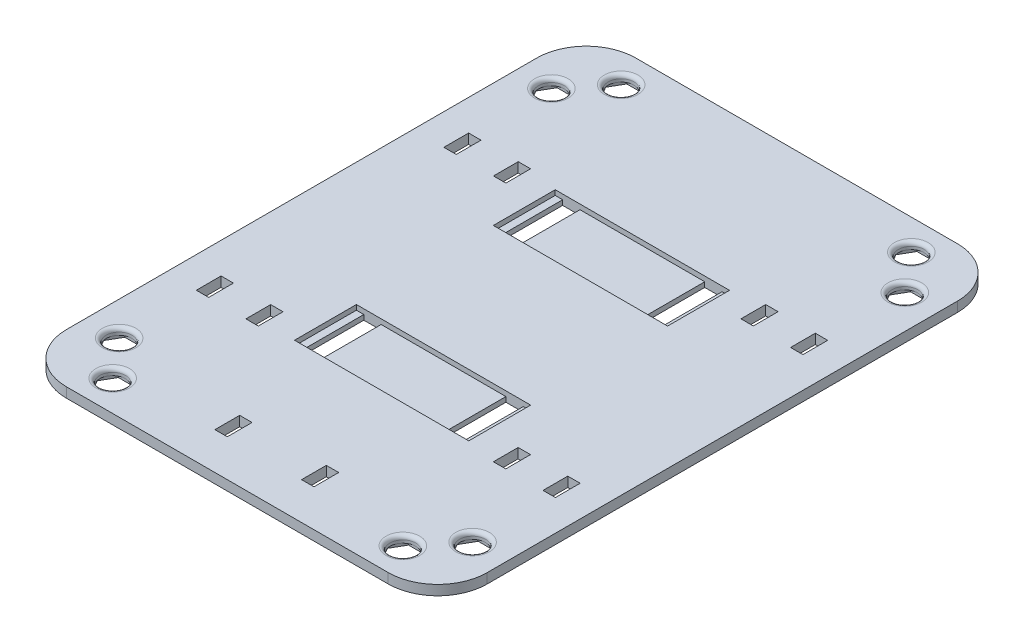
from build123d import *

# Parameters (mm, degrees)
SKETCH1_W           = 107.95
SKETCH1_H           = 146.05
BOSS_EXTRUDE1_DEPTH = 2.54
SKETCH2_R           = 3.302
CUT_EXTRUDE1_DEPTH  = 91.842736914
SKETCH3_W           = 4.445
SKETCH3_H           = 15.875
CUT_EXTRUDE2_DEPTH  = 91.842736914
FILLET1_R           = 12.7
SKETCH11_W          = 44.699936
SKETCH11_H          = 15.875
CUT_EXTRUDE9_DEPTH  = 1.27
FILLET2_R           = 1.016
SKETCH14_W          = 3.175
SKETCH14_H          = 6.35
CUT_EXTRUDE14_DEPTH = 91.842736914
CUT_EXTRUDE15_DEPTH = 0.79375


with BuildPart() as part:
    # Sketch1 → Boss-Extrude1 (new body)
    with BuildSketch(Plane(origin=(0, 0, 0), x_dir=(1, 0, 0), z_dir=(0, 1, 0))):
        Rectangle(SKETCH1_W, SKETCH1_H)
    extrude(amount=-BOSS_EXTRUDE1_DEPTH)

    # Sketch2 → Cut-Extrude1 (cut, through all)
    with BuildSketch(Plane(origin=(0, 0, 0), x_dir=(1, 0, 0), z_dir=(0, 1, 0))):
        with Locations((-37.218937681, 65.210784985)):
            Circle(SKETCH2_R)
        with Locations((45.326413441, 55.435363088)):
            Circle(SKETCH2_R)
        with Locations((37.218937681, 65.210784985)):
            Circle(SKETCH2_R)
        with Locations((-45.326413441, -55.435363088)):
            Circle(SKETCH2_R)
        with Locations((-45.326413441, 55.435363088)):
            Circle(SKETCH2_R)
        with Locations((-37.218937681, -65.210784985)):
            Circle(SKETCH2_R)
        with Locations((37.218937681, -65.210784985)):
            Circle(SKETCH2_R)
        with Locations((45.326413441, -55.435363088)):
            Circle(SKETCH2_R)
    extrude(amount=-CUT_EXTRUDE1_DEPTH, mode=Mode.SUBTRACT)

    # Sketch3 → Cut-Extrude2 (cut, through all)
    with BuildSketch(Plane(origin=(0, 0, 0), x_dir=(1, 0, 0), z_dir=(0, 1, 0))):
        with Locations((-18.222468, 25.499949)):
            Rectangle(SKETCH3_W, SKETCH3_H)
        with Locations((18.222468, 25.499949)):
            Rectangle(SKETCH3_W, SKETCH3_H)
        with Locations((18.222468, -25.499949)):
            Rectangle(SKETCH3_W, SKETCH3_H)
        with Locations((-18.222468, -25.499949)):
            Rectangle(SKETCH3_W, SKETCH3_H)
    extrude(amount=-CUT_EXTRUDE2_DEPTH, mode=Mode.SUBTRACT)

    # Fillet1
    fillet1_edges = [part.edges().sort_by_distance(p)[0] for p in [
        (53.975, -1.27, -73.025),
        (53.975, -1.27, 73.025),
        (-53.975, -1.27, 73.025),
        (-53.975, -1.27, -73.025),
    ]]
    fillet(fillet1_edges, radius=FILLET1_R)

    # Sketch11 → Cut-Extrude9 (cut, symmetric)
    with BuildSketch(Plane(origin=(0, 0, 0), x_dir=(1, 0, 0), z_dir=(0, 1, 0))):
        with Locations((0, -25.499949)):
            Rectangle(SKETCH11_W, SKETCH11_H)
        with Locations((0, 25.499949)):
            Rectangle(SKETCH11_W, SKETCH11_H)
    extrude(amount=CUT_EXTRUDE9_DEPTH, both=True, mode=Mode.SUBTRACT)

    # Fillet2
    fillet2_edges = [part.edges().sort_by_distance(p)[0] for p in [
        (-40.520937681, 0, -65.210784985),
        (33.916937681, 0, 65.210784985),
        (42.024413441, 0, 55.435363088),
        (-40.520937681, 0, 65.210784985),
        (-48.628413441, 0, 55.435363088),
        (42.024413441, 0, -55.435363088),
        (33.916937681, 0, -65.210784985),
        (-48.628413441, 0, -55.435363088),
    ]]
    fillet(fillet2_edges, radius=FILLET2_R)

    # Sketch14 → Cut-Extrude14 (cut, through all)
    with BuildSketch(Plane(origin=(0, 0, 0), x_dir=(1, 0, 0), z_dir=(0, 1, 0))):
        with Locations((31.7373, -31.75)):
            Rectangle(SKETCH14_W, SKETCH14_H)
        with Locations((-31.7373, -31.75)):
            Rectangle(SKETCH14_W, SKETCH14_H)
        with Locations((-31.7373, 31.75)):
            Rectangle(SKETCH14_W, SKETCH14_H)
        with Locations((31.7373, 31.75)):
            Rectangle(SKETCH14_W, SKETCH14_H)
        with Locations((-11.1125, -60.325)):
            Rectangle(SKETCH14_W, SKETCH14_H)
        with Locations((11.1125, -60.325)):
            Rectangle(SKETCH14_W, SKETCH14_H)
        with Locations((44.4627, 31.75)):
            Rectangle(SKETCH14_W, SKETCH14_H)
        with Locations((44.4627, -31.75)):
            Rectangle(SKETCH14_W, SKETCH14_H)
        with Locations((-44.4627, 31.75)):
            Rectangle(SKETCH14_W, SKETCH14_H)
        with Locations((-44.4627, -31.75)):
            Rectangle(SKETCH14_W, SKETCH14_H)
    extrude(amount=-CUT_EXTRUDE14_DEPTH, mode=Mode.SUBTRACT)

    # Sketch17 → Cut-Extrude15 (cut)
    with BuildSketch(Plane.XZ.offset(2.54)):
        Polygon((43.346679368, -52.006363088), (47.306147514, -52.006363088), (49.285881587, -55.435363088), (47.306147514, -58.864363088), (43.346679368, -58.864363088), (41.366945295, -55.435363088), align=None)
        Polygon((-41.366945295, -55.435363088), (-43.346679368, -52.006363088), (-47.306147514, -52.006363088), (-49.285881587, -55.435363088), (-47.306147514, -58.864363088), (-43.346679368, -58.864363088), align=None)
        Polygon((-33.259469535, -65.210784985), (-35.239203608, -61.781784985), (-39.198671754, -61.781784985), (-41.178405827, -65.210784985), (-39.198671754, -68.639784985), (-35.239203608, -68.639784985), align=None)
        Polygon((35.239203608, -61.781784985), (39.198671754, -61.781784985), (41.178405827, -65.210784985), (39.198671754, -68.639784985), (35.239203608, -68.639784985), (33.259469535, -65.210784985), align=None)
        Polygon((-41.366945295, 55.435363088), (-43.346679368, 52.006363088), (-47.306147514, 52.006363088), (-49.285881587, 55.435363088), (-47.306147514, 58.864363088), (-43.346679368, 58.864363088), align=None)
        Polygon((-33.259469535, 65.210784985), (-35.239203608, 61.781784985), (-39.198671754, 61.781784985), (-41.178405827, 65.210784985), (-39.198671754, 68.639784985), (-35.239203608, 68.639784985), align=None)
        Polygon((39.198671754, 68.639784985), (35.239203608, 68.639784985), (33.259469535, 65.210784985), (35.239203608, 61.781784985), (39.198671754, 61.781784985), (41.178405827, 65.210784985), align=None)
        Polygon((47.306147514, 58.864363088), (43.346679368, 58.864363088), (41.366945295, 55.435363088), (43.346679368, 52.006363088), (47.306147514, 52.006363088), (49.285881587, 55.435363088), align=None)
    extrude(amount=-CUT_EXTRUDE15_DEPTH, mode=Mode.SUBTRACT)


solid = part.part
